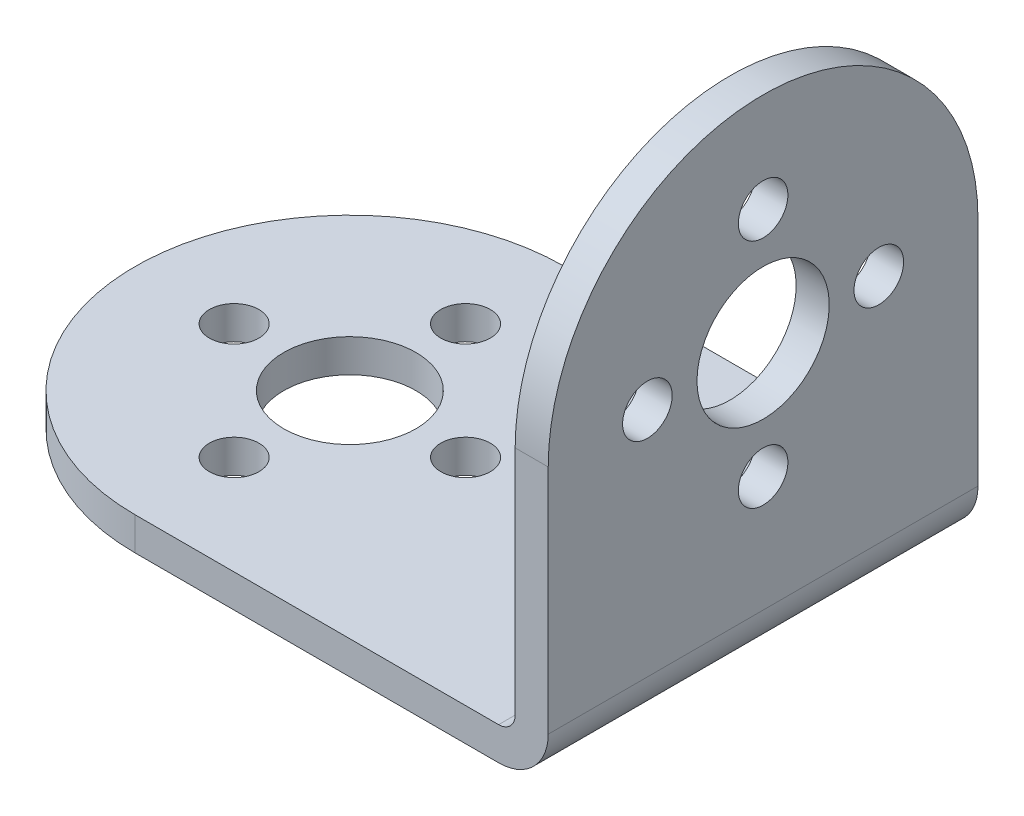
from build123d import *

# Parameters (mm, degrees)
EXTRUDE_1_DEPTH     = 26
FILLET_1_R          = 1
FILLET_2_R          = 3
SKETCH_2_R          = 4
SKETCH_2_R_2        = 1.5
CUT_EXTRUDE_1_DEPTH = 26
SKETCH_3_R          = 4
SKETCH_3_R_2        = 1.5
CUT_EXTRUDE_2_DEPTH = 26


with BuildPart() as part:
    # 草图1 → 凸台-拉伸1 (new body)
    with BuildSketch(Plane.XY):
        Polygon((-19, -15), (19, -15), (19, 15), (17, 15), (17, -13), (-19, -13), align=None)
    extrude(amount=EXTRUDE_1_DEPTH)

    # 圆角1
    fillet_1_edges = [part.edges().sort_by_distance(p)[0] for p in [
        (17, -13, 13),
    ]]
    fillet(fillet_1_edges, radius=FILLET_1_R)

    # 圆角2
    fillet_2_edges = [part.edges().sort_by_distance(p)[0] for p in [
        (19, -15, 13),
    ]]
    fillet(fillet_2_edges, radius=FILLET_2_R)

    # 草图2 → 切除-拉伸1 (cut)
    with BuildSketch(Plane.ZY.offset(-17)):
        with BuildLine():
            Line((26, 15), (13, 15))
            ThreePointArc((13, 15), (22.192388155, 11.192388155), (26, 2))
            Line((26, 2), (26, 15))
        make_face()
        with BuildLine():
            Line((0, 15), (0, 2))
            ThreePointArc((0, 2), (3.807611845, 11.192388155), (13, 15))
            Line((13, 15), (0, 15))
        make_face()
        with Locations((13, 2)):
            Circle(SKETCH_2_R)
        with Locations((13, 9)):
            Circle(SKETCH_2_R_2)
        with Locations((20, 2)):
            Circle(SKETCH_2_R_2)
        with Locations((13, -5)):
            Circle(SKETCH_2_R_2)
        with Locations((6, 2)):
            Circle(SKETCH_2_R_2)
    extrude(amount=-CUT_EXTRUDE_1_DEPTH, mode=Mode.SUBTRACT)

    # 草图3 → 切除-拉伸2 (cut)
    with BuildSketch(Plane(origin=(0, -13, 0), x_dir=(1, 0, 0), z_dir=(0, 1, 0))):
        with BuildLine():
            ThreePointArc((-19, -13), (-15.192388155, -3.807611845), (-6, 0))
            Line((-6, 0), (-19, 0))
            Line((-19, 0), (-19, -13))
        make_face()
        with BuildLine():
            ThreePointArc((-6, -26), (-15.192388155, -22.192388155), (-19, -13))
            Line((-19, -13), (-19, -26))
            Line((-19, -26), (-6, -26))
        make_face()
        with Locations((-6, -13)):
            Circle(SKETCH_3_R)
        with Locations((-13, -13)):
            Circle(SKETCH_3_R_2)
        with Locations((-6, -6)):
            Circle(SKETCH_3_R_2)
        with Locations((1, -13)):
            Circle(SKETCH_3_R_2)
        with Locations((-6, -20)):
            Circle(SKETCH_3_R_2)
    extrude(amount=-CUT_EXTRUDE_2_DEPTH, mode=Mode.SUBTRACT)


solid = part.part
